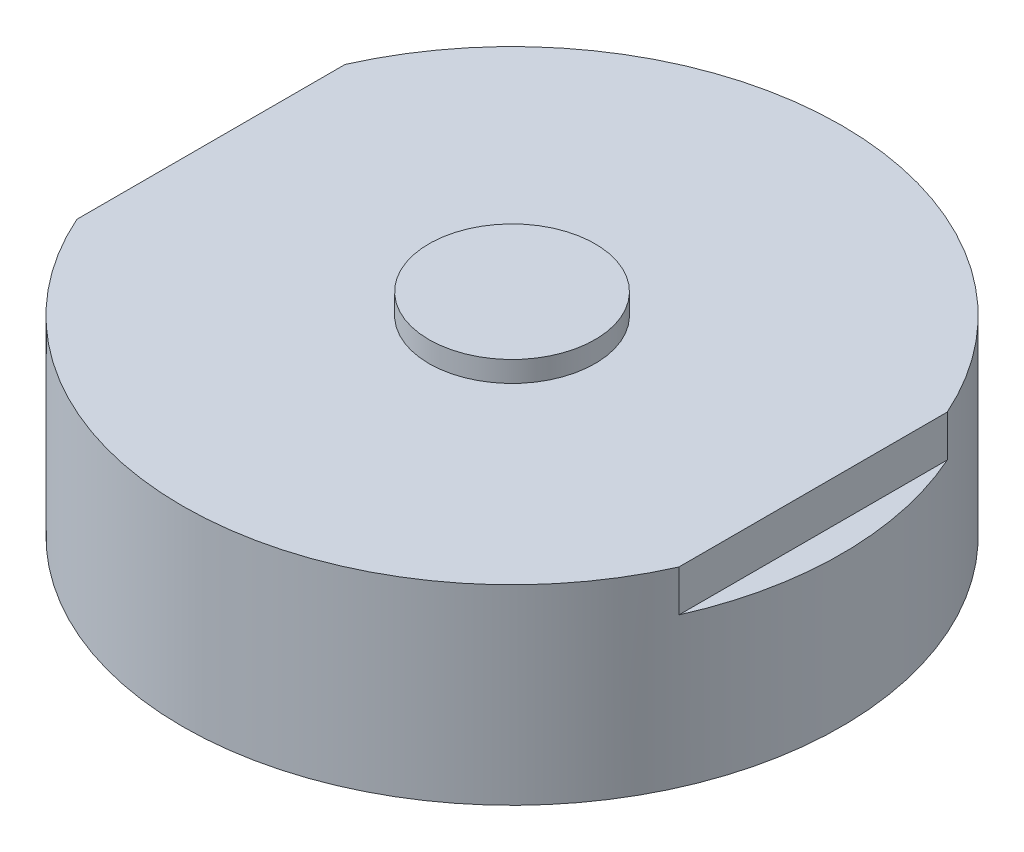
from build123d import *

# Parameters (mm, degrees)
SKETCH1_R               = 15.875
BOSS_EXTRUDE1_DEPTH     = 9.2
SKETCH2_W               = 2.259426776
SKETCH2_H               = 16.292984729
SKETCH2_W_2             = 2.453909841
SKETCH2_H_2             = 18.61191006
CUT_EXTRUDE2_DEPTH      = 2
SKETCH3_R               = 4
BOSS_EXTRUDE3_DEPTH     = 1
BOSS_EXTRUDE4_START     = -5
BOSS_EXTRUDE4_OUTLINE_R = 1.7
BOSS_EXTRUDE4_DEPTH     = 5


# Read off the part's stored shape, not the designer's step: Boss-Extrude4
with BuildPart() as part:
    # Sketch1 → Boss-Extrude1 (new body)
    with BuildSketch(Plane(origin=(0, 0, 0), x_dir=(1, 0, 0), z_dir=(0, 1, 0))):
        with Locations(Location((0, 0, 0), (0, 0, 270))):
            Circle(SKETCH1_R)
    extrude(amount=BOSS_EXTRUDE1_DEPTH)

    # Sketch2 → Cut-Extrude2 (cut)
    with BuildSketch(Plane(origin=(0, 9.2, 0), x_dir=(1, 0, 0), z_dir=(0, 1, 0))):
        with Locations((-15.629713388, -0.847675915)):
            Rectangle(SKETCH2_W, SKETCH2_H)
        with Locations((15.726954921, -2.007138581)):
            Rectangle(SKETCH2_W_2, SKETCH2_H_2)
    extrude(amount=-CUT_EXTRUDE2_DEPTH, mode=Mode.SUBTRACT)

    # Sketch3 → Boss-Extrude3 (add)
    with BuildSketch(Plane(origin=(0, 9.2, 0), x_dir=(1, 0, 0), z_dir=(0, 1, 0))):
        with Locations(Location((0, 0, 0), (0, 0, 270))):
            Circle(SKETCH3_R)
    extrude(amount=BOSS_EXTRUDE3_DEPTH)

    # Boss-Extrude4 outline → Boss-Extrude4 (cut)
    with BuildSketch(Plane.XZ.offset(BOSS_EXTRUDE4_START)):
        with Locations((0, 12.7)):
            Circle(BOSS_EXTRUDE4_OUTLINE_R)
        with Locations((0, -12.7)):
            Circle(BOSS_EXTRUDE4_OUTLINE_R)
    extrude(amount=BOSS_EXTRUDE4_DEPTH, mode=Mode.SUBTRACT)


solid = part.part
